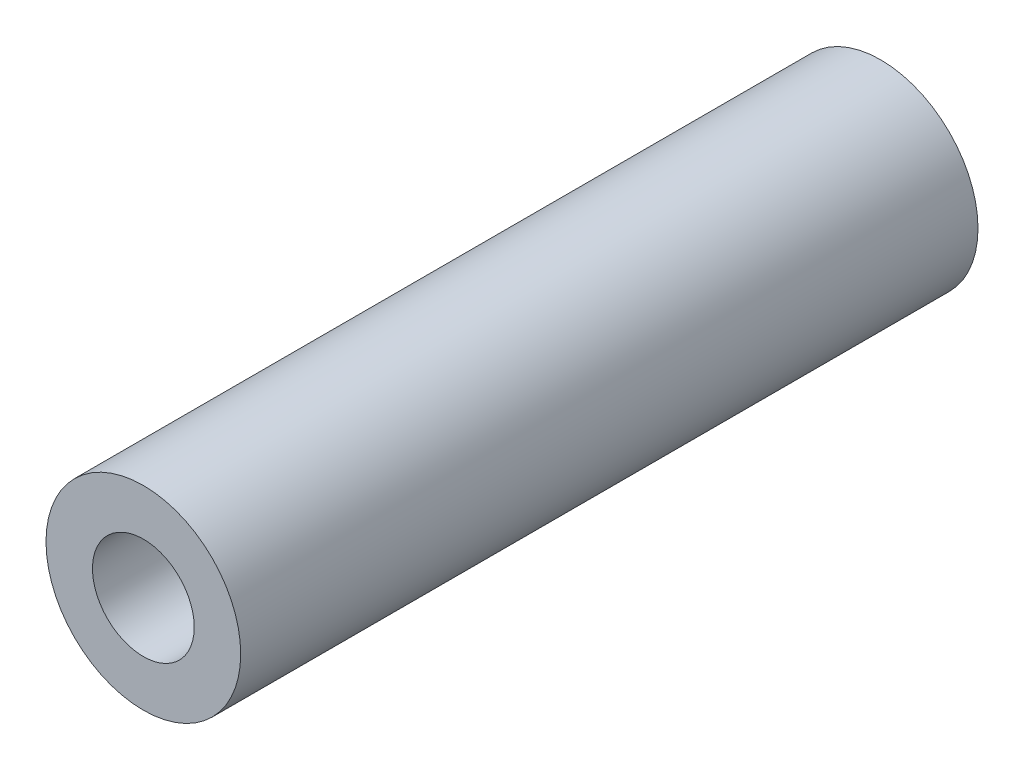
from build123d import *

# Parameters (mm, degrees)
SKETCH1_R           = 4.7625
SKETCH1_R_2         = 2.4892
BOSS_EXTRUDE1_DEPTH = 18.034


with BuildPart() as part:
    # Sketch1 → Boss-Extrude1 (new, symmetric)
    with BuildSketch(Plane.XY):
        Circle(SKETCH1_R)
        Circle(SKETCH1_R_2, mode=Mode.SUBTRACT)
    extrude(amount=BOSS_EXTRUDE1_DEPTH, both=True)


solid = part.part
